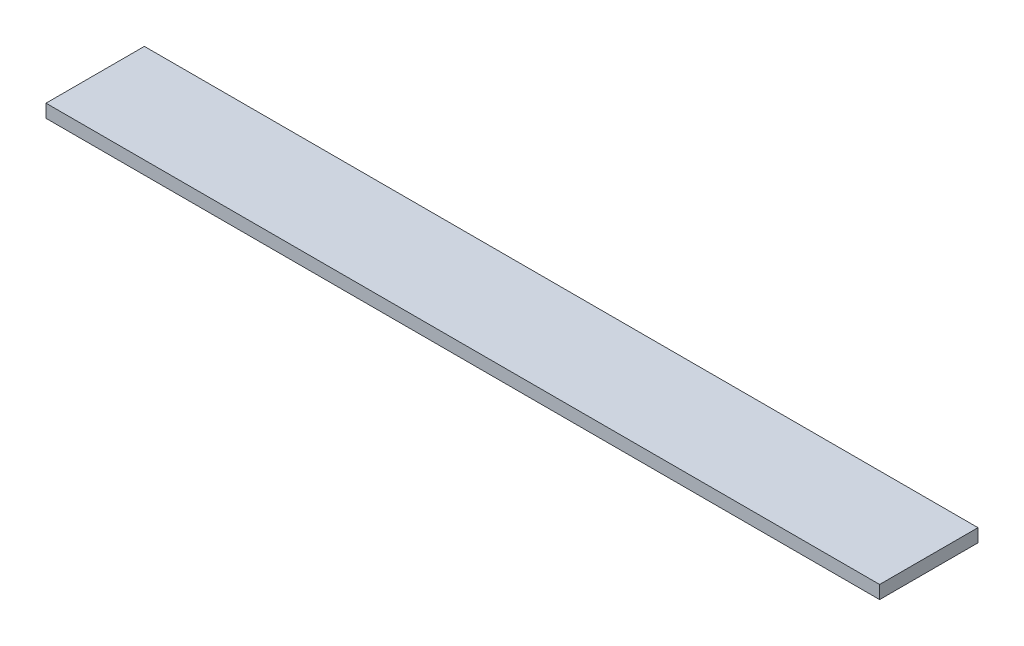
from build123d import *

# Parameters (mm, degrees)
SKETCH1_W           = 805
SKETCH1_H           = 95
BOSS_EXTRUDE1_DEPTH = 12.7


with BuildPart() as part:
    # Sketch1 → Boss-Extrude1 (new body)
    with BuildSketch(Plane(origin=(0, 0, 0), x_dir=(1, 0, 0), z_dir=(0, 1, 0))):
        with Locations((402.5, 47.5)):
            Rectangle(SKETCH1_W, SKETCH1_H)
    extrude(amount=BOSS_EXTRUDE1_DEPTH)


solid = part.part
